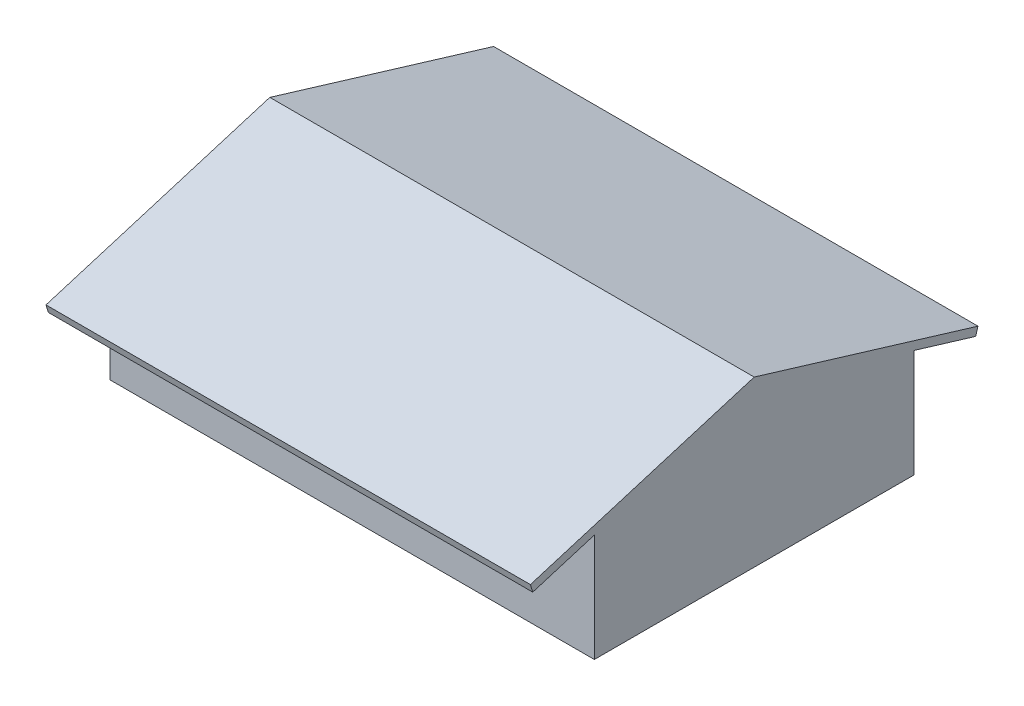
from build123d import *

# Parameters (mm, degrees)
BOSS_EXTRUDE1_DEPTH = 7620


with BuildPart() as part:
    # Sketch1 → Boss-Extrude1 (new, symmetric)
    with BuildSketch(Plane(origin=(0, 0, 0), x_dir=(0, 0, -1), z_dir=(1, 0, 0))):
        Polygon((-5029.2, 0), (5029.2, 0), (5029.2, 3392.19401994), (6967.218121598, 2804.915801274), (7040.88, 3048), (5029.2, 3657.6), (0, 5181.6), (-5029.2, 3657.6), (-7040.88, 3048), (-6967.218121598, 2804.915801274), (-5029.2, 3392.19401994), align=None)
    extrude(amount=BOSS_EXTRUDE1_DEPTH, both=True)


solid = part.part
